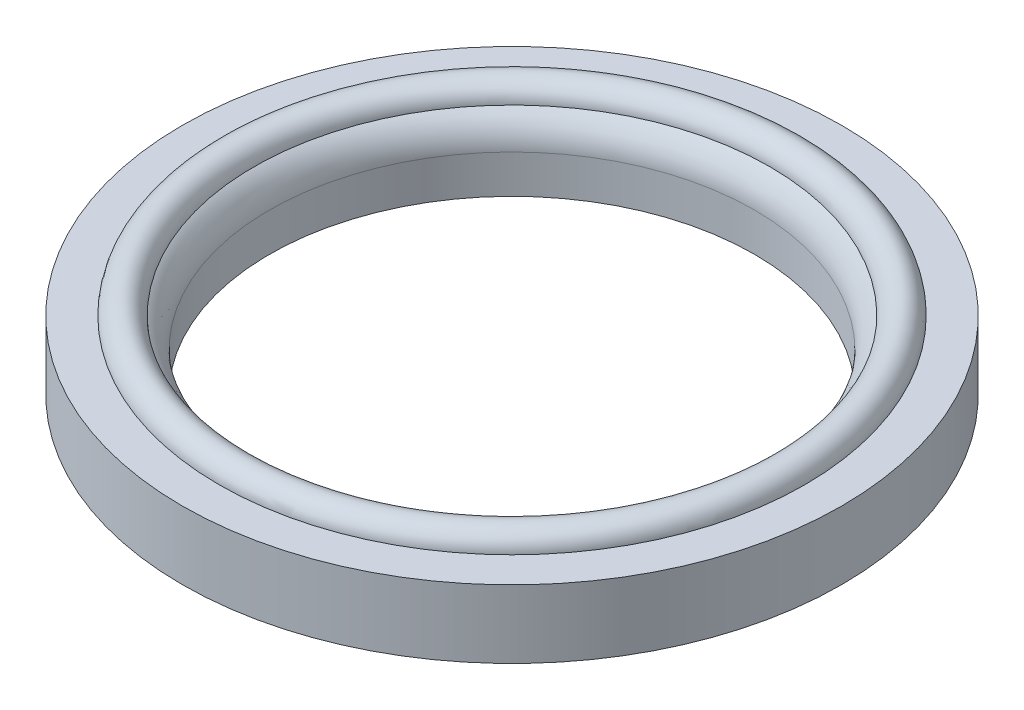
from build123d import *

# Parameters (mm, degrees)
SKETCH1_R           = 23.0505
SKETCH1_R_2         = 16.9545
BOSS_EXTRUDE1_DEPTH = 4.7625
FILLET1_R           = 2.54


with BuildPart() as part:
    # Sketch1 → Boss-Extrude1 (new body)
    with BuildSketch(Plane(origin=(0, 0, 0), x_dir=(1, 0, 0), z_dir=(0, 1, 0))):
        with Locations(Location((0, 0, 0), (0, 0, 90))):
            Circle(SKETCH1_R)
        with Locations(Location((0, 0, 0), (0, 0, 90))):
            Circle(SKETCH1_R_2, mode=Mode.SUBTRACT)
    extrude(amount=BOSS_EXTRUDE1_DEPTH)

    # Sketch2 → Revolve1 (revolve)
    with BuildSketch(Plane.XY, mode=Mode.PRIVATE) as revolve1_sk:
        with BuildLine():
            Line((18.034, 4.710412046), (20.477314517, 4.739986951))
            ThreePointArc((20.477314517, 4.739986951), (19.240869806, 5.946856757), (18.034, 4.710412046))
        make_face()
    revolve(revolve1_sk.sketch.rotate(Axis((0, 0, 0), (0, 1, 0)), 90), axis=Axis((0, 0, 0), (0, 1, 0)))

    # Fillet1
    # the kernel refuses this fillet: 2.54 mm, written as the material it takes off along each edge
    with BuildSketch(Plane(origin=(0, 4.7625, 0), x_dir=(0, 0, -1), z_dir=(1, 0, 0))) as fillet1_piece_1:
        with BuildLine():
            CenterArc((19.4945, -2.078446948), FILLET1_R, 125.086398031, 54.913601969)
            Line((18.03448004, 0), (18.005279641, 0.041568939))
            ThreePointArc((18.005279641, 0.041568939), (17.49449002, 0.0508), (16.9545, 0.0508))
            Line((16.9545, 0.0508), (16.9037, 0))
            Line((16.9037, 0), (16.9037, -2.078446948))
            Line((16.9037, -2.078446948), (16.9545, -2.078446948))
        make_face()
    revolve(axis=Axis((0, 4.7625, 0), (0, 1, 0)), mode=Mode.SUBTRACT)


solid = part.part
